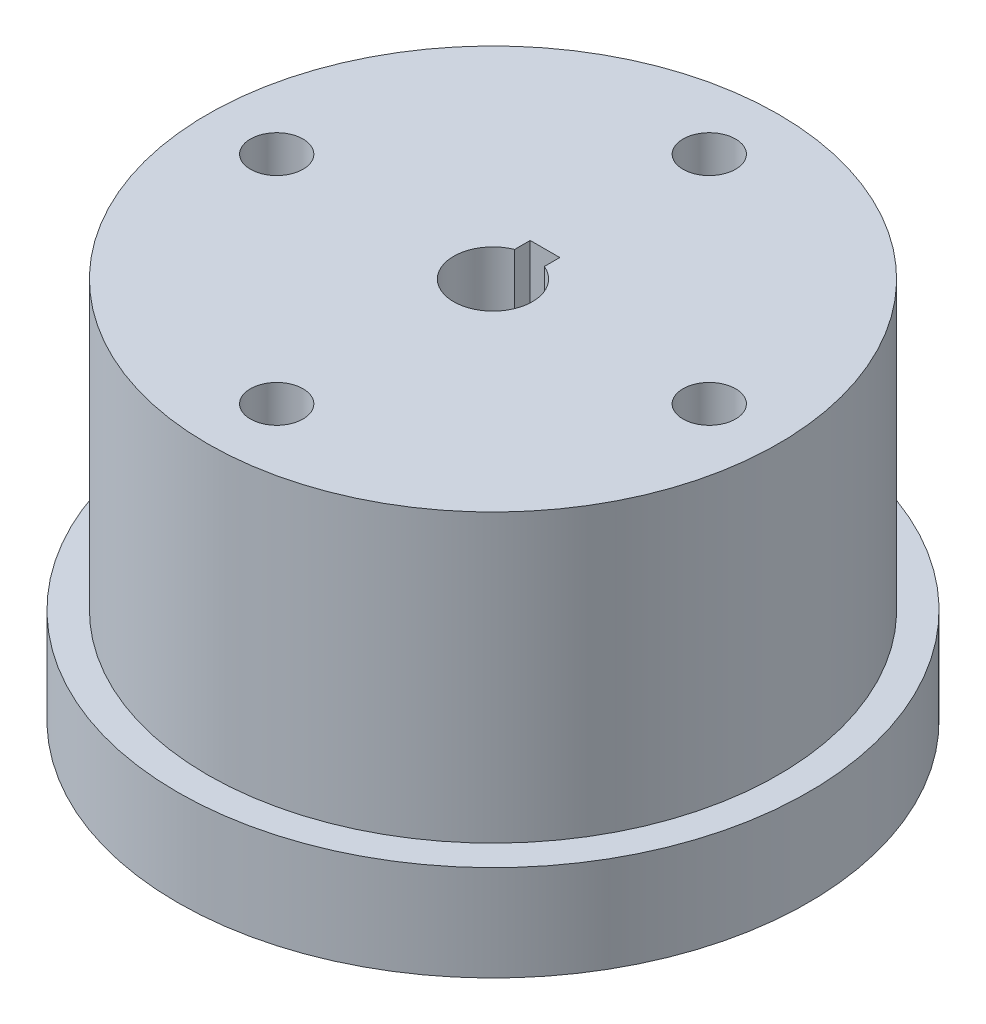
from build123d import *

# Parameters (mm, degrees)
SKETCH1_R           = 33
BOSS_EXTRUDE1_DEPTH = 10
SKETCH2_R           = 29.86
BOSS_EXTRUDE2_DEPTH = 30
SKETCH3_R           = 2.75
CUT_EXTRUDE1_DEPTH  = 54
CUT_EXTRUDE2_DEPTH  = 54


with BuildPart() as part:
    # Sketch1 → Boss-Extrude1 (new body)
    with BuildSketch(Plane(origin=(0, 0, 0), x_dir=(1, 0, 0), z_dir=(0, 1, 0))):
        Circle(SKETCH1_R)
    extrude(amount=BOSS_EXTRUDE1_DEPTH)

    # Sketch2 → Boss-Extrude2 (add)
    with BuildSketch(Plane(origin=(0, 10, 0), x_dir=(1, 0, 0), z_dir=(0, 1, 0))):
        Circle(SKETCH2_R)
    extrude(amount=BOSS_EXTRUDE2_DEPTH)

    # Sketch3 → Cut-Extrude1 (cut)
    with BuildSketch(Plane(origin=(0, 40, 0), x_dir=(1, 0, 0), z_dir=(0, 1, 0))):
        with Locations((0, 22.627416998)):
            Circle(SKETCH3_R)
        with Locations((-22.627416998, 0)):
            Circle(SKETCH3_R)
        with Locations((22.627416998, 0)):
            Circle(SKETCH3_R)
        with Locations((0, -22.627416998)):
            Circle(SKETCH3_R)
    extrude(amount=-CUT_EXTRUDE1_DEPTH, mode=Mode.SUBTRACT)

    # Sketch4 → Cut-Extrude2 (cut)
    with BuildSketch(Plane(origin=(0, 40, 0), x_dir=(1, 0, 0), z_dir=(0, 1, 0))):
        with BuildLine():
            Line((-1.55, 5.44), (-1.55, 3.817315811))
            ThreePointArc((-1.55, 3.817315811), (0, -4.12), (1.55, 3.817315811))
            Line((1.55, 3.817315811), (1.55, 5.44))
            Line((1.55, 5.44), (-1.55, 5.44))
        make_face()
    extrude(amount=-CUT_EXTRUDE2_DEPTH, mode=Mode.SUBTRACT)


solid = part.part
